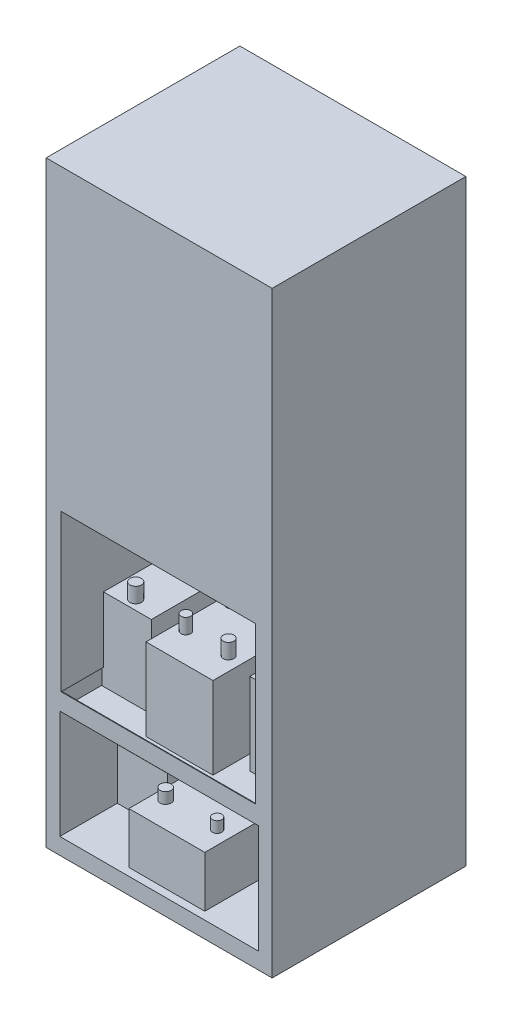
from build123d import *

# Parameters (mm, degrees)
CROQUIS1_W              = 700
CROQUIS1_H              = 600
SALIENTE_EXTRUIR1_DEPTH = 1850
CROQUIS2_W              = 615.213502424
CROQUIS2_H              = 336.389596981
CORTAR_EXTRUIR1_DEPTH   = 1850
CROQUIS3_W              = 601.471689429
CROQUIS3_H              = 484.058253594
CORTAR_EXTRUIR2_DEPTH   = 1850
VACIADO1_START          = 927
VACIADO1_OUTLINE_W      = 696
VACIADO1_OUTLINE_H      = 596
VACIADO1_DEPTH          = 921
VACIADO1_START_2        = 2
VACIADO1_2_OUTLINE_W    = 38.393248788
VACIADO1_2_OUTLINE_H    = 596
VACIADO1_2_DEPTH        = 925
VACIADO1_START_3        = 389.289586049
VACIADO1_3_OUTLINE_W    = 619.213502424
VACIADO1_3_OUTLINE_H    = 596
VACIADO1_3_DEPTH        = 51.652160357
VACIADO1_4_OUTLINE_W    = 619.213502424
VACIADO1_4_OUTLINE_H    = 596
VACIADO1_4_DEPTH        = 46.899989068
VACIADO1_START_4        = 440.941746406
VACIADO1_5_OUTLINE_W    = 9.875527386
VACIADO1_5_OUTLINE_H    = 596
VACIADO1_5_OUTLINE_W_2  = 3.866285609
VACIADO1_5_DEPTH        = 486.058253594
CROQUIS4_W              = 155.811040743
CROQUIS4_H              = 337.39949018
CROQUIS4_W_2            = 207.292949962
CROQUIS4_H_2            = 473.99302583
CROQUIS4_W_3            = 153.187153329
CROQUIS4_H_3            = 334.913299481
SALIENTE_EXTRUIR2_DEPTH = 254
CROQUIS5_R              = 17.695739631
CROQUIS5_R_2            = 14.878547438
CROQUIS5_R_3            = 20.046068399
CROQUIS5_R_4            = 15.612705271
CROQUIS5_R_5            = 20.069748599
CROQUIS5_R_6            = 21.515316786
CROQUIS5_R_7            = 19.11675051
CROQUIS5_R_8            = 16.429789051
SALIENTE_EXTRUIR3_DEPTH = 47
CROQUIS6_W              = 235.100540812
CROQUIS6_H              = 552.359872766
CROQUIS6_W_2            = 155.124272019
CROQUIS6_H_2            = 243.948410626
CROQUIS6_W_3            = 136.509991439
SALIENTE_EXTRUIR4_DEPTH = 158
CROQUIS7_R              = 21.309931324
CROQUIS7_R_2            = 19.709234989
CROQUIS7_R_3            = 17.138465207
CROQUIS7_R_4            = 14.538713976
CROQUIS7_R_5            = 19.196161078
CROQUIS7_R_6            = 15.424618687
CROQUIS7_R_7            = 17.995388468
CROQUIS7_R_8            = 20.519963126
CROQUIS7_R_9            = 17.445012433
CROQUIS7_R_10           = 21.115852911
SALIENTE_EXTRUIR5_DEPTH = 34
SALIENTE_EXTRUIR6_DEPTH = 34
CROQUIS9_W              = 97.267284717
CROQUIS9_H              = 79.582323859
CROQUIS9_W_2            = 256.431932435
CROQUIS9_H_2            = 154.743407504
CORTAR_EXTRUIR3_DEPTH   = 0.2
CORTAR_EXTRUIR4_DEPTH   = 0.2
CROQUIS11_R             = 8.638199992
CROQUIS11_R_2           = 9.502019992
CORTAR_EXTRUIR5_DEPTH   = 0.2
MATRIZL1_COUNT          = 36
MATRIZL1_PITCH          = 50
CROQUIS12_R             = 7.900023995
CORTAR_EXTRUIR6_DEPTH   = 0.2
MATRIZL2_COUNT          = 30
MATRIZL2_PITCH          = 20


# Read off the part's stored shape, not the designer's step: Vaciado1
with BuildPart() as part:
    # Croquis1 → Saliente-Extruir1 (new body)
    with BuildSketch(Plane(origin=(0, 0, 0), x_dir=(1, 0, 0), z_dir=(0, 1, 0))):
        Rectangle(CROQUIS1_W, CROQUIS1_H)
    extrude(amount=SALIENTE_EXTRUIR1_DEPTH)

    # Croquis2 → Cortar-Extruir1 (cut)
    with BuildSketch(Plane.XY.offset(300)):
        with Locations((0, 219.094787559)):
            Rectangle(CROQUIS2_W, CROQUIS2_H)
    extrude(amount=-CORTAR_EXTRUIR1_DEPTH, mode=Mode.SUBTRACT)

    # Croquis3 → Cortar-Extruir2 (cut)
    with BuildSketch(Plane.XY.offset(300)):
        with Locations((-3.004620888, 682.970873203)):
            Rectangle(CROQUIS3_W, CROQUIS3_H)
    extrude(amount=-CORTAR_EXTRUIR2_DEPTH, mode=Mode.SUBTRACT)

    # Vaciado1 outline → Vaciado1 (cut)
    with BuildSketch(Plane(origin=(0, 0, 0), x_dir=(1, 0, 0), z_dir=(0, 1, 0)).offset(VACIADO1_START)):
        Rectangle(VACIADO1_OUTLINE_W, VACIADO1_OUTLINE_H)
    extrude(amount=VACIADO1_DEPTH, mode=Mode.SUBTRACT)

    # Vaciado1 2 outline → Vaciado1 2 (cut)
    with BuildSketch(Plane(origin=(0, 0, 0), x_dir=(1, 0, 0), z_dir=(0, 1, 0)).offset(VACIADO1_START_2)):
        with Locations((328.803375606, 0)):
            Rectangle(VACIADO1_2_OUTLINE_W, VACIADO1_2_OUTLINE_H)
        with Locations((-328.803375606, 0)):
            Rectangle(VACIADO1_2_OUTLINE_W, VACIADO1_2_OUTLINE_H)
    extrude(amount=VACIADO1_2_DEPTH, mode=Mode.SUBTRACT)

    # Vaciado1 3 outline → Vaciado1 3 (cut)
    with BuildSketch(Plane(origin=(0, 0, 0), x_dir=(1, 0, 0), z_dir=(0, 1, 0)).offset(VACIADO1_START_3)):
        Rectangle(VACIADO1_3_OUTLINE_W, VACIADO1_3_OUTLINE_H)
    extrude(amount=VACIADO1_3_DEPTH, mode=Mode.SUBTRACT)

    # Vaciado1 4 outline → Vaciado1 4 (cut)
    with BuildSketch(Plane(origin=(0, 0, 0), x_dir=(1, 0, 0), z_dir=(0, 1, 0)).offset(VACIADO1_START_2)):
        Rectangle(VACIADO1_4_OUTLINE_W, VACIADO1_4_OUTLINE_H)
    extrude(amount=VACIADO1_4_DEPTH, mode=Mode.SUBTRACT)

    # Vaciado1 5 outline → Vaciado1 5 (cut)
    with BuildSketch(Plane(origin=(0, 0, 0), x_dir=(1, 0, 0), z_dir=(0, 1, 0)).offset(VACIADO1_START_4)):
        with Locations((304.668987519, 0)):
            Rectangle(VACIADO1_5_OUTLINE_W, VACIADO1_5_OUTLINE_H)
        with Locations((-307.673608408, 0)):
            Rectangle(VACIADO1_5_OUTLINE_W_2, VACIADO1_5_OUTLINE_H)
    extrude(amount=VACIADO1_5_DEPTH, mode=Mode.SUBTRACT)

    # Croquis4 → Saliente-Extruir2 (add)
    with BuildSketch(Plane(origin=(0, 389.289586049, 0), x_dir=(1, 0, 0), z_dir=(0, 1, 0))):
        with Locations((227.516652399, 0)):
            Rectangle(CROQUIS4_W, CROQUIS4_H)
        Rectangle(CROQUIS4_W_2, CROQUIS4_H_2)
        with Locations((-232.063289137, -1.24309535)):
            Rectangle(CROQUIS4_W_3, CROQUIS4_H_3)
    extrude(amount=SALIENTE_EXTRUIR2_DEPTH)

    # Croquis5 → Saliente-Extruir3 (add)
    with BuildSketch(Plane(origin=(0, 643.289586049, 0), x_dir=(1, 0, 0), z_dir=(0, 1, 0))):
        with Locations(Location((230.044615203, -120.710223911, 0), (0, 0, 270))):
            Circle(CROQUIS5_R)
        with Locations(Location((230.044615203, 47.399302583, 0), (0, 0, 270))):
            Circle(CROQUIS5_R)
        with Locations(Location((-71.150795338, -146.026983278, 0), (0, 0, 270))):
            Circle(CROQUIS5_R_2)
        with Locations(Location((-71.150795338, 0, 0), (0, 0, 270))):
            Circle(CROQUIS5_R_3)
        with Locations(Location((-234.150032562, -138.405963542, 0), (0, 0, 270))):
            Circle(CROQUIS5_R)
        with Locations(Location((-234.150032562, 47.399302583, 0), (0, 0, 270))):
            Circle(CROQUIS5_R_4)
        with Locations(Location((-71.150795338, 166.603557417, 0), (0, 0, 270))):
            Circle(CROQUIS5_R_5)
        with Locations(Location((61.00370715, 0, 0), (0, 0, 270))):
            Circle(CROQUIS5_R_6)
        with Locations(Location((61.00370715, 166.603557417, 0), (0, 0, 270))):
            Circle(CROQUIS5_R_7)
        with Locations(Location((61.00370715, -146.026983278, 0), (0, 0, 270))):
            Circle(CROQUIS5_R_8)
    extrude(amount=SALIENTE_EXTRUIR3_DEPTH)

    # Croquis6 → Saliente-Extruir4 (add)
    with BuildSketch(Plane(origin=(0, 50.899989068, 0), x_dir=(1, 0, 0), z_dir=(0, 1, 0))):
        Rectangle(CROQUIS6_W, CROQUIS6_H)
        with Locations((-230.044615203, 0)):
            Rectangle(CROQUIS6_W_2, CROQUIS6_H_2)
        with Locations((221.196745388, 0)):
            Rectangle(CROQUIS6_W_3, CROQUIS6_H_2)
    extrude(amount=SALIENTE_EXTRUIR4_DEPTH)

    # Croquis7 → Saliente-Extruir5 (add)
    with BuildSketch(Plane(origin=(0, 208.899989068, 0), x_dir=(1, 0, 0), z_dir=(0, 1, 0))):
        with Locations(Location((220.490094395, -83.441653157, 0), (0, 0, 270))):
            Circle(CROQUIS7_R)
        with Locations(Location((220.490094395, 65.548722345, 0), (0, 0, 270))):
            Circle(CROQUIS7_R_2)
        with Locations(Location((-83.717663037, -196.012159091, 0), (0, 0, 270))):
            Circle(CROQUIS7_R_3)
        with Locations(Location((75.670063393, -196.012159091, 0), (0, 0, 270))):
            Circle(CROQUIS7_R_4)
        with Locations(Location((-83.717663037, 0, 0), (0, 0, 270))):
            Circle(CROQUIS7_R_5)
        with Locations(Location((75.670063393, 5.952572144, 0), (0, 0, 270))):
            Circle(CROQUIS7_R_6)
        with Locations(Location((-83.717663037, 184.741022746, 0), (0, 0, 270))):
            Circle(CROQUIS7_R_7)
        with Locations(Location((75.670063393, 184.741022746, 0), (0, 0, 270))):
            Circle(CROQUIS7_R_8)
        with Locations(Location((-230.044615203, -62.131721832, 0), (0, 0, 270))):
            Circle(CROQUIS7_R_9)
        with Locations(Location((-230.044615203, 45.839487356, 0), (0, 0, 270))):
            Circle(CROQUIS7_R_10)
    extrude(amount=SALIENTE_EXTRUIR5_DEPTH)

    # Croquis8 → Saliente-Extruir6 (add)
    with BuildSketch(Plane(origin=(0, 0, -300), x_dir=(-1, 0, 0), z_dir=(0, 0, -1))):
        with BuildLine():
            Line((-250.090251242, 1244.393397196), (250.090251242, 1244.393397196))
            ThreePointArc((250.090251242, 1244.393397196), (285.445590301, 1259.038058137), (300.090251242, 1294.393397196))
            Line((300.090251242, 1294.393397196), (300.090251242, 1716.628379876))
            ThreePointArc((300.090251242, 1716.628379876), (285.445590301, 1751.983718936), (250.090251242, 1766.628379876))
            Line((250.090251242, 1766.628379876), (-250.090251242, 1766.628379876))
            ThreePointArc((-250.090251242, 1766.628379876), (-285.445590301, 1751.983718936), (-300.090251242, 1716.628379876))
            Line((-300.090251242, 1716.628379876), (-300.090251242, 1294.393397196))
            ThreePointArc((-300.090251242, 1294.393397196), (-285.445590301, 1259.038058137), (-250.090251242, 1244.393397196))
        make_face()
    extrude(amount=SALIENTE_EXTRUIR6_DEPTH)

    # Croquis9 → Cortar-Extruir3 (cut)
    with BuildSketch(Plane(origin=(0, 0, -334), x_dir=(-1, 0, 0), z_dir=(0, 0, -1))):
        with Locations((-229.966996705, 1694.072352924)):
            Rectangle(CROQUIS9_W, CROQUIS9_H)
        with Locations((126.153098606, 1414.321877841)):
            Rectangle(CROQUIS9_W_2, CROQUIS9_H_2)
    extrude(amount=-CORTAR_EXTRUIR3_DEPTH, mode=Mode.SUBTRACT)

    # Croquis10 → Cortar-Extruir4 (cut)
    with BuildSketch(Plane(origin=(0, 0, -334), x_dir=(-1, 0, 0), z_dir=(0, 0, -1))):
        Polygon((-261.818280674, 1336.501887961), (-253.086288653, 1402.647721295), (-252.238265149, 1402.647721295), (-224.929258238, 1348.374217021), (-197.686503163, 1402.647721295), (-196.825229291, 1402.647721295), (-188.040235802, 1336.501887961), (-194.002901066, 1336.501887961), (-200.336576614, 1384.097207139), (-224.213738406, 1336.501887961), (-225.552025499, 1336.501887961), (-249.521939862, 1384.203210077), (-255.842365042, 1336.501887961), align=None)
        Polygon((-174.471859733, 1402.647721295), (-137.158825545, 1402.647721295), (-137.158825545, 1395.86353326), (-168.535695204, 1395.86353326), (-168.535695204, 1375.510969158), (-137.158825545, 1375.510969158), (-137.158825545, 1368.726781124), (-168.535695204, 1368.726781124), (-168.535695204, 1343.286075995), (-137.158825545, 1343.286075995), (-137.158825545, 1336.501887961), (-174.471859733, 1336.501887961), align=None)
        with BuildLine():
            Line((-104.085908879, 1402.647721295), (-98.149744349, 1402.647721295))
            Line((-98.149744349, 1402.647721295), (-98.149744349, 1357.98073328))
            add(Edge.make_bspline(
                [(-98.149744349, 1357.98073328), (-98.155677037, 1357.15475758), (-98.167068523, 1355.568783448), (-98.229706936, 1353.284410713), (-98.345622367, 1351.198536137), (-98.514483466, 1349.306416678), (-98.739761676, 1347.613979993), (-98.997560868, 1346.108148972), (-99.309633107, 1344.801491285), (-99.779579717, 1343.334275485), (-100.550158805, 1341.725158937), (-101.709922769, 1339.987316061), (-103.150631869, 1338.467220353), (-104.819416275, 1337.147087011), (-106.730861225, 1336.0952316), (-108.845604354, 1335.340126294), (-111.150627658, 1334.879546116), (-112.749452058, 1334.830902374), (-113.573171833, 1334.805840953)],
                knots=[0, 0, 0, 0, 1.237770943, 2.376671248, 3.424123796, 4.367912054, 5.222547132, 5.982086412, 6.656319012, 7.234008312, 8.288027371, 9.317870876, 10.352700517, 11.413286737, 12.494591526, 13.606319346, 14.766767577, 16, 16, 16, 16], degree=3))
            add(Edge.make_bspline(
                [(-113.573171833, 1334.805840953), (-114.214944377, 1334.826263179), (-115.506233243, 1334.86735405), (-117.428066579, 1335.20227333), (-119.344443206, 1335.71851403), (-121.265534575, 1336.474515461), (-123.229295535, 1337.502716504), (-125.262322623, 1338.848024793), (-127.390766857, 1340.507936081), (-128.792742651, 1341.774869666), (-129.526614007, 1342.438052491)],
                knots=[0, 0, 0, 0, 0.848567217, 1.707373443, 2.573483905, 3.470863513, 4.432650262, 5.500696352, 6.691726801, 8, 8, 8, 8], degree=3))
            Line((-129.526614007, 1342.438052491), (-126.028517052, 1347.526193517))
            add(Edge.make_bspline(
                [(-126.028517052, 1347.526193517), (-125.221487255, 1346.969672785), (-123.697709768, 1345.918889078), (-121.458116912, 1344.567121481), (-119.473795717, 1343.408148858), (-118.175769778, 1342.817517988), (-117.574782744, 1342.544055429)],
                knots=[0, 0, 0, 0, 1.196737151, 2.259595785, 3.194191475, 4, 4, 4, 4], degree=3))
            add(Edge.make_bspline(
                [(-117.574782744, 1342.544055429), (-117.210332213, 1342.401190685), (-116.495563565, 1342.121001108), (-115.402738399, 1341.808303327), (-114.316150646, 1341.637412544), (-113.595771611, 1341.60563735), (-113.241912651, 1341.590028987)],
                knots=[0, 0, 0, 0, 1.051806502, 2.062826769, 3.048436908, 4, 4, 4, 4], degree=3))
            add(Edge.make_bspline(
                [(-113.241912651, 1341.590028987), (-112.784886739, 1341.60935746), (-111.881515021, 1341.647562724), (-110.568728229, 1341.984892777), (-109.312750556, 1342.49977956), (-108.158606728, 1343.253677523), (-107.094879919, 1344.150074908), (-106.217165804, 1345.234035191), (-105.485455975, 1346.435356615), (-105.045119509, 1347.57252546), (-104.76457099, 1348.609628443), (-104.586513459, 1349.562754671), (-104.430812585, 1350.677056423), (-104.295089804, 1351.95386378), (-104.215630315, 1353.395732996), (-104.126479475, 1354.99843034), (-104.094252074, 1356.765996537), (-104.088774805, 1357.998405897), (-104.085908879, 1358.643251643)],
                knots=[0, 0, 0, 0, 0.997221856, 1.971139923, 2.944579524, 3.951425367, 4.971190333, 5.972282193, 6.985401279, 8.033996657, 8.624075553, 9.332086008, 10.151144245, 11.082816738, 12.137127781, 13.306538797, 14.590673636, 16, 16, 16, 16], degree=3))
            Line((-104.085908879, 1358.643251643), (-104.085908879, 1402.647721295))
        make_face()
    extrude(amount=-CORTAR_EXTRUIR4_DEPTH, mode=Mode.SUBTRACT)

    # Croquis11 → Cortar-Extruir5 (cut)
    with BuildSketch(Plane(origin=(0, 0, -300), x_dir=(-1, 0, 0), z_dir=(0, 0, -1))):
        with Locations((-331.130309437, 1826.04943374)):
            Circle(CROQUIS11_R)
        with Locations((331.419629984, 1826.04943374)):
            Circle(CROQUIS11_R_2)
    cortar_extruir5 = extrude(amount=-CORTAR_EXTRUIR5_DEPTH, mode=Mode.SUBTRACT)

    # MatrizL1: Cortar-Extruir5 ×36
    with Locations(*[(0, -i * MATRIZL1_PITCH, 0) for i in range(1, MATRIZL1_COUNT)]):
        add(cortar_extruir5, mode=Mode.SUBTRACT)

    # Croquis12 → Cortar-Extruir6 (cut)
    with BuildSketch(Plane(origin=(0, 0, -300), x_dir=(-1, 0, 0), z_dir=(0, 0, -1))):
        with Locations((-277.566481046, 414.720161713)):
            Circle(CROQUIS12_R)
    cortar_extruir6 = extrude(amount=-CORTAR_EXTRUIR6_DEPTH, mode=Mode.SUBTRACT)

    # MatrizL2: Cortar-Extruir6 ×30
    with Locations(*[(-i * MATRIZL2_PITCH, 0, 0) for i in range(1, MATRIZL2_COUNT)]):
        add(cortar_extruir6, mode=Mode.SUBTRACT)


solid = part.part
